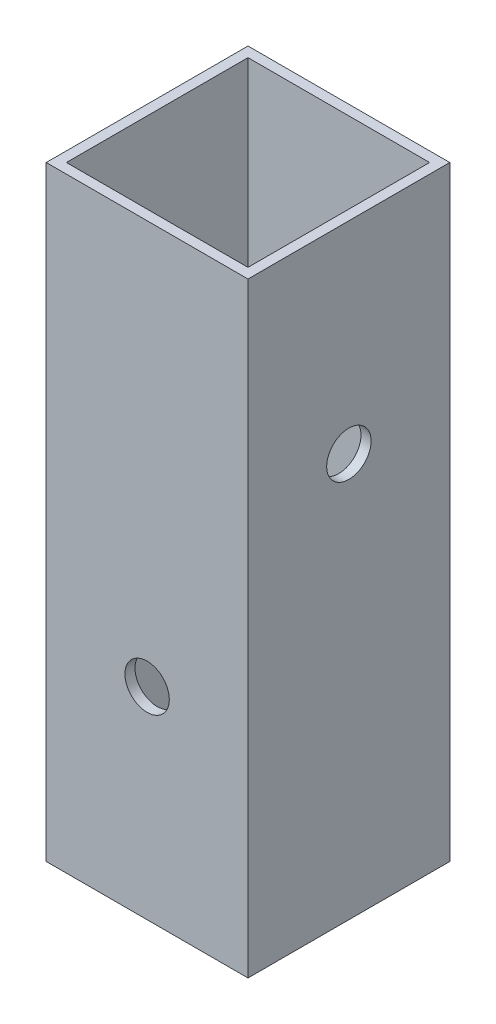
from build123d import *

# Parameters (mm, degrees)
EXTRUDE_1_DEPTH     = 280
SKETCH_2_R          = 2.2
CUT_EXTRUDE_1_DEPTH = 280
SKETCH_3_R          = 2.2
CUT_EXTRUDE_2_DEPTH = 20
CUT_EXTRUDE_3_DEPTH = 59
EXTRUDE_3_DEPTH     = 20
SKETCH_6_W          = 4.4
SKETCH_6_H          = 18.003548725
CUT_EXTRUDE_4_DEPTH = 20


with BuildPart() as part:
    # 草图1 → 凸台-拉伸1 (new body)
    with BuildSketch(Plane(origin=(0, 0, 0), x_dir=(1, 0, 0), z_dir=(0, 1, 0))):
        Polygon((10, 0), (10, 10), (0, 10), (-10, 10), (-10, 0), (-10, -10), (0, -10), (10, -10), align=None)
        Polygon((9, 0), (9, 9), (0, 9), (-9, 9), (-9, 0), (-9, -9), (0, -9), (9, -9), align=None, mode=Mode.SUBTRACT)
    extrude(amount=-EXTRUDE_1_DEPTH)

    # 草图2 → 切除-拉伸1 (cut)
    with BuildSketch(Plane.XY.offset(10)):
        with Locations((0, -40)):
            Circle(SKETCH_2_R)
        with Locations((0, -80)):
            Circle(SKETCH_2_R)
        with Locations((0, -120)):
            Circle(SKETCH_2_R)
        with Locations((0, -180)):
            Circle(SKETCH_2_R)
        with Locations((0, -220)):
            Circle(SKETCH_2_R)
        with Locations((0, -260)):
            Circle(SKETCH_2_R)
    extrude(amount=-CUT_EXTRUDE_1_DEPTH, mode=Mode.SUBTRACT)

    # 草图3 → 切除-拉伸2 (cut)
    with BuildSketch(Plane(origin=(10, 0, 0), x_dir=(0, 0, -1), z_dir=(1, 0, 0))):
        with Locations((0, -60)):
            Circle(SKETCH_3_R)
        with Locations((0, -100)):
            Circle(SKETCH_3_R)
        with Locations((0, -150)):
            Circle(SKETCH_3_R)
        with Locations((0, -200)):
            Circle(SKETCH_3_R)
        with Locations((0, -240)):
            Circle(SKETCH_3_R)
    extrude(amount=-CUT_EXTRUDE_2_DEPTH, mode=Mode.SUBTRACT)

    # 草图4 → 切除-拉伸3 (cut)
    with BuildSketch(Plane.XY.offset(10)):
        Polygon((0, -220), (10, -220), (10, 0), (-10, 0), (-10, -220), align=None)
    extrude(amount=-CUT_EXTRUDE_3_DEPTH, mode=Mode.SUBTRACT)

    # 草图5 → 凸台-拉伸3 (add)
    with BuildSketch(Plane.XY.offset(10)):
        with BuildLine():
            Line((-2.2, -220), (2.2, -220))
            ThreePointArc((2.2, -220), (0, -222.2), (-2.2, -220))
        make_face()
    extrude(amount=-EXTRUDE_3_DEPTH)

    # 草图6 → 切除-拉伸4 (cut)
    with BuildSketch(Plane(origin=(0, -220, 0), x_dir=(1, 0, 0), z_dir=(0, 1, 0))):
        with Locations((0, -0.001774362)):
            Rectangle(SKETCH_6_W, SKETCH_6_H)
    extrude(amount=-CUT_EXTRUDE_4_DEPTH, mode=Mode.SUBTRACT)


solid = part.part
